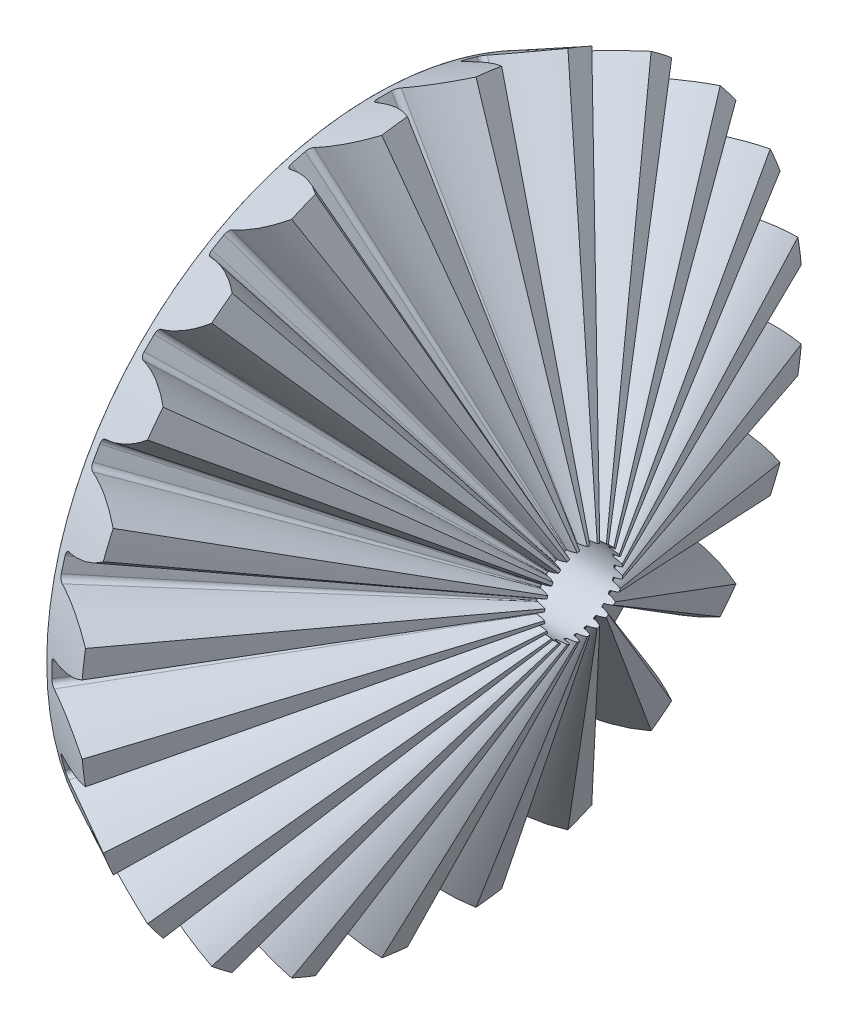
from build123d import *

# Parameters (mm, degrees)
TEETHCUTS_COUNT = 24
TEETHCUTS_ANGLE = 345
HUBSKE_R        = 16.713981404
HUB_DEPTH       = 0.0001016
BORSKE_R        = 2
BORE_DEPTH      = 11.572087991


with BuildPart() as part:
    # BasProSke → Base-Revolve (revolve)
    with BuildSketch(Plane(origin=(0, 0, 0), x_dir=(1, 0, 0), z_dir=(0, 1, 0)), mode=Mode.PRIVATE) as base_revolve_sk:
        Polygon((0, 0), (0, 16.713981408), (3.450811908, 18.439387356), (10.759914643, 1.843938725), (10.414833454, 1.671398131), (10.414833454, 0), align=None)
    revolve(base_revolve_sk.sketch.rotate(Axis((-10, 0, 0), (1, 0, 0)), 180), axis=Axis((-10, 0, 0), (1, 0, 0)))

    # ToothCut: read off the stored shape, not the designer's step
    # ToothCut: loft between two sections, ruled curve by curve
    toothcut_from = [
        Edge.make_bspline([(11.58062868, 0.004295744, -0.008307975), (11.575160662, 0.001561735, -0.015376263), (11.566827079, -0.002605057, -0.01465242), (11.562401083, -0.004818055, -0.006724752)], [0, 0, 0, 0, 1, 1, 1, 1], 3, [1, 0.729081985, 0.729081985, 1]),
        Edge.make_bspline([(11.562401083, -0.004818055, 0.006724752), (11.566827079, -0.002605057, 0.01465242), (11.575160662, 0.001561735, 0.015376263), (11.58062868, 0.004295744, 0.008307975)], [0, 0, 0, 0, 1, 1, 1, 1], 3, [1, 0.729081985, 0.729081985, 1]),
        Edge.make_bspline([(11.562401083, -0.004818055, -0.006724752), (11.561829247, -0.005103973, -0.005700503), (11.561392944, -0.005322124, -0.00459602), (11.561100972, -0.005468111, -0.003433578)], [0, 0, 0, 0, 1, 1, 1, 1], 3, [1, 0.99327801, 0.99327801, 1]),
        Edge.make_bspline([(11.561100972, -0.005468111, 0.003433578), (11.561392944, -0.005322124, 0.00459602), (11.561829247, -0.005103973, 0.005700503), (11.562401083, -0.004818055, 0.006724752)], [0, 0, 0, 0, 1, 1, 1, 1], 3, [1, 0.99327801, 0.99327801, 1]),
        Edge.make_bspline([(11.561100972, -0.005468111, -0.003433578), (11.560533346, -0.005751924, -0.001173665), (11.560533346, -0.005751924, 0.001173665), (11.561100972, -0.005468111, 0.003433578)], [0, 0, 0, 0, 1, 1, 1, 1], 3, [1, 0.975172775, 0.975172775, 1]),
        Edge.make_line((11.58062868, 0.004295744, 0.008307975), (11.58062868, 0.004295744, -0.008307975)),
    ]
    toothcut_to = [
        Edge.make_bspline([(3.700196816, 18.56407981, -1.973416724), (2.821258103, 18.124610455, -1.255748571), (1.810493918, 17.619228364, -0.804462787), (0.731170799, 17.079566806, -0.647806602)], [0, 0, 0, 0, 1, 1, 1, 1], 3, [1, 0.979135741, 0.979135741, 1]),
        Edge.make_bspline([(0.731170799, 17.079566806, 0.647806602), (1.810493918, 17.619228364, 0.804462787), (2.821258103, 18.124610455, 1.255748571), (3.700196816, 18.56407981, 1.973416724)], [0, 0, 0, 0, 1, 1, 1, 1], 3, [1, 0.979135741, 0.979135741, 1]),
        Edge.make_bspline([(0.731170799, 17.079566806, -0.647806602), (0.596215833, 17.012089323, -0.628218835), (0.507575329, 16.967769071, -0.512770534), (0.510701628, 16.969332221, -0.360660322)], [0, 0, 0, 0, 1, 1, 1, 1], 3, [1, 0.829076098, 0.829076098, 1]),
        Edge.make_bspline([(0.510701628, 16.969332221, 0.360660322), (0.507575329, 16.967769071, 0.512770534), (0.596215833, 17.012089323, 0.628218835), (0.731170799, 17.079566806, 0.647806602)], [0, 0, 0, 0, 1, 1, 1, 1], 3, [1, 0.829076098, 0.829076098, 1]),
        Edge.make_bspline([(0.510701628, 16.969332221, -0.360660322), (0.515642926, 16.97180287, -0.120241262), (0.515642926, 16.97180287, 0.120241262), (0.510701628, 16.969332221, 0.360660322)], [0, 0, 0, 0, 1, 1, 1, 1], 3, [1, 0.999824061, 0.999824061, 1]),
        Edge.make_line((3.700196816, 18.56407981, 1.973416724), (3.700196816, 18.56407981, -1.973416724)),
    ]
    toothcut = Solid(Shell([*[Face.make_surface_from_curves(toothcut_from[k], toothcut_to[k]) for k in range(6)], Face(Wire(toothcut_from)), Face(Wire(toothcut_to))]))
    add(toothcut, mode=Mode.SUBTRACT)

    # TeethCuts: ToothCut ×24 about axis
    teethcuts_axis = Axis((-10, 0, 0), (1, 0, 0))
    for i in range(1, TEETHCUTS_COUNT):
        add(toothcut.rotate(teethcuts_axis, i * TEETHCUTS_ANGLE / (TEETHCUTS_COUNT - 1)), mode=Mode.SUBTRACT)

    # HubSke → Hub (add)
    with BuildSketch(Plane.ZY):
        Circle(HUBSKE_R)
    extrude(amount=HUB_DEPTH)

    # BorSke → Bore (cut, symmetric)
    with BuildSketch(Plane(origin=(0, 0, 0), x_dir=(0, 0, -1), z_dir=(1, 0, 0))):
        with Locations(Location((0, 0, 0), (0, 0, 180))):
            Circle(BORSKE_R)
    extrude(amount=BORE_DEPTH, both=True, mode=Mode.SUBTRACT)


solid = part.part
